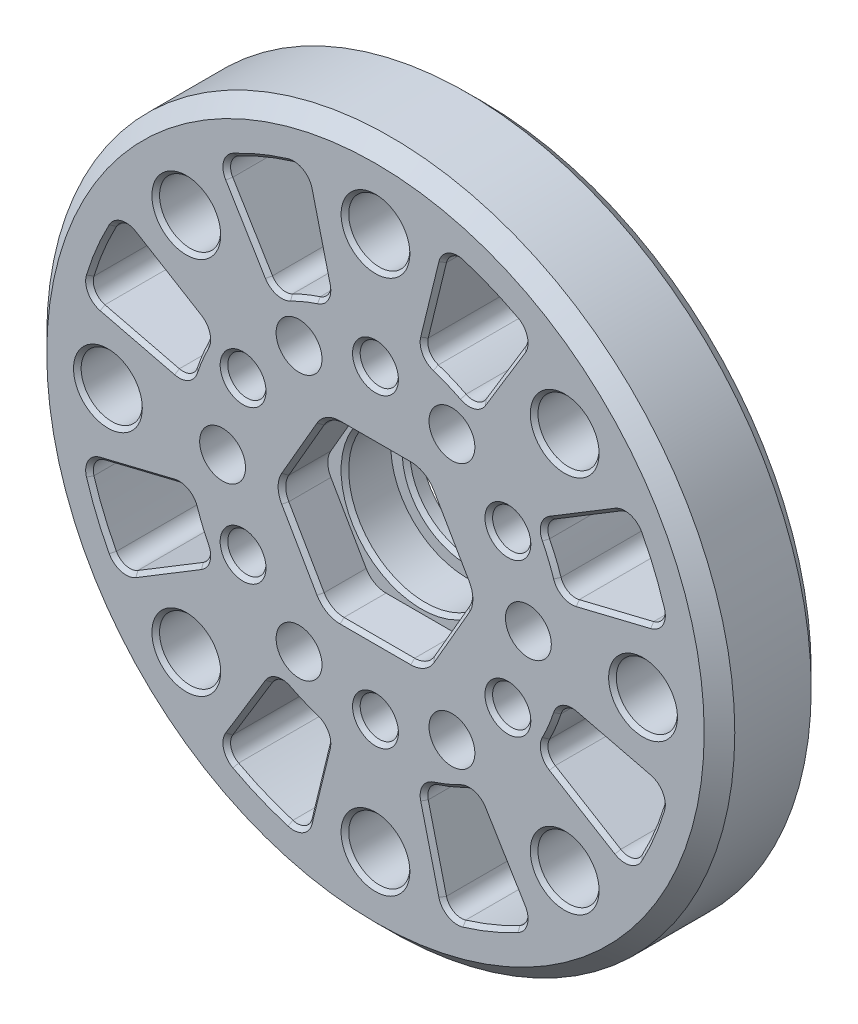
from build123d import *

# Parameters (mm, degrees)
SKETCH_1_R                       = 22.5
SKETCH_1_R_2                     = 2
EXTRUDE_1_DEPTH                  = 7
SKETCH_7_R                       = 5
SKETCH_7_R_2                     = 0.5
CUT_EXTRUDE_3_DEPTH              = 33.580669115
M3X0_5_1_D                       = 2.5
M3X0_5_1_CSINK_D                 = 3
M3X0_5_1_CSINK_ANGLE             = 90
CHAMFER_1_SIZE                   = 1
CUT_EXTRUDE_4_DEPTH              = 33.580669115
FILLET_1_R                       = 1
PATTERN_CIRCULAR_1_COUNT         = 8
FILLET_1_OF_PATTERN_CIRCULAR_1_R = 1
EXTRUDE_START                    = 1
SKETCH_12_R                      = 5
SKETCH_12_R_2                    = 4
EXTRUDE_3_DEPTH                  = 1
CHAMFER_3_SIZE                   = 0.25
CUT_EXTRUDE_6_DEPTH              = 3
FILLET_4_R                       = 1.5
CHAMFER_5_SIZE                   = 0.25
CHAMFER_8_SIZE                   = 0.25
SKETCH_18_R                      = 1.5
CUT_EXTRUDE_7_DEPTH              = 33.580669115


with BuildPart() as part:
    # ｽｹｯﾁ1 → ﾎﾞｽ - 押し出し1 (new body)
    with BuildSketch(Plane.XY):
        Circle(SKETCH_1_R)
        with Locations((0, 17.5)):
            Circle(SKETCH_1_R_2, mode=Mode.SUBTRACT)
        with Locations((12.374368671, 12.374368671)):
            Circle(SKETCH_1_R_2, mode=Mode.SUBTRACT)
        with Locations((17.5, 0)):
            Circle(SKETCH_1_R_2, mode=Mode.SUBTRACT)
        with Locations((12.374368671, -12.374368671)):
            Circle(SKETCH_1_R_2, mode=Mode.SUBTRACT)
        with Locations((0, -17.5)):
            Circle(SKETCH_1_R_2, mode=Mode.SUBTRACT)
        with Locations((-12.374368671, -12.374368671)):
            Circle(SKETCH_1_R_2, mode=Mode.SUBTRACT)
        with Locations((-17.5, 0)):
            Circle(SKETCH_1_R_2, mode=Mode.SUBTRACT)
        with Locations((-12.374368671, 12.374368671)):
            Circle(SKETCH_1_R_2, mode=Mode.SUBTRACT)
    extrude(amount=EXTRUDE_1_DEPTH)

    # ｽｹｯﾁ7 → ｶｯﾄ - 押し出し3 (cut, through all)
    with BuildSketch(Plane.XY.offset(7)):
        Circle(SKETCH_7_R)
        with Locations((0, 10)):
            Circle(SKETCH_7_R_2)
        with Locations((8.660254038, 5)):
            Circle(SKETCH_7_R_2)
        with Locations((8.660254038, -5)):
            Circle(SKETCH_7_R_2)
        with Locations((0, -10)):
            Circle(SKETCH_7_R_2)
        with Locations((-8.660254038, -5)):
            Circle(SKETCH_7_R_2)
        with Locations((-8.660254038, 5)):
            Circle(SKETCH_7_R_2)
    extrude(amount=-CUT_EXTRUDE_3_DEPTH, mode=Mode.SUBTRACT)

    # M3x0.5 ねじ穴1 (through all)
    with Locations(Plane.XY.offset(7)):
        with Locations((0, 10), (8.660254038, 5), (8.660254038, -5), (0, -10), (-8.660254038, -5), (-8.660254038, 5)):
            CounterSinkHole(M3X0_5_1_D / 2, M3X0_5_1_CSINK_D / 2, counter_sink_angle=M3X0_5_1_CSINK_ANGLE)

    # 面取り1
    chamfer_1_edges = [part.edges().sort_by_distance(p)[0] for p in [
        (-22.5, 0, 0),
        (-22.5, 0, 7),
    ]]
    chamfer(chamfer_1_edges, length=CHAMFER_1_SIZE)

    # ｽｹｯﾁ10 → ｶｯﾄ - 押し出し4 (cut, through all)
    with BuildSketch(Plane.XY.offset(7)):
        with BuildLine():
            Line((6.484665727, 10.686398383), (10.116078534, 16.670781478))
            ThreePointArc((10.116078534, 16.670781478), (7.462326931, 18.015650884), (4.6348749, 18.941170361))
            Line((4.6348749, 18.941170361), (2.971073654, 12.141775873))
            ThreePointArc((2.971073654, 12.141775873), (4.783542905, 11.548494156), (6.484665727, 10.686398383))
        make_face()
    cut_extrude_4 = extrude(amount=-CUT_EXTRUDE_4_DEPTH, mode=Mode.SUBTRACT)

    # ﾌｨﾚｯﾄ1
    fillet_1_edges = [part.edges().sort_by_distance(p)[0] for p in [
        (6.484665727, 10.686398383, 3.5),
        (2.971073654, 12.141775873, 3.5),
        (10.116078534, 16.670781478, 3.5),
        (4.6348749, 18.941170361, 3.5),
    ]]
    fillet(fillet_1_edges, radius=FILLET_1_R)

    # 円形ﾊﾟﾀｰﾝ1: ｶｯﾄ - 押し出し4 ×8 about axis
    pattern_circular_1_axis = Axis((0, 0, 0), (0, 0, 1))
    for i in range(1, PATTERN_CIRCULAR_1_COUNT):
        add(cut_extrude_4.rotate(pattern_circular_1_axis, i * 360 / PATTERN_CIRCULAR_1_COUNT), mode=Mode.SUBTRACT)

    # ﾌｨﾚｯﾄ1 of 円形ﾊﾟﾀｰﾝ1
    fillet_1_of_pattern_circular_1_edges = [part.edges().sort_by_distance(p)[0] for p in [
        (-2.971073654, 12.141775873, 3.5),
        (-6.484665727, 10.686398383, 3.5),
        (-4.6348749, 18.941170361, 3.5),
        (-10.116078534, 16.670781478, 3.5),
        (-10.686398383, 6.484665727, 3.5),
        (-12.141775873, 2.971073654, 3.5),
        (-16.670781478, 10.116078534, 3.5),
        (-18.941170361, 4.6348749, 3.5),
        (-12.141775873, -2.971073654, 3.5),
        (-10.686398383, -6.484665727, 3.5),
        (-18.941170361, -4.6348749, 3.5),
        (-16.670781478, -10.116078534, 3.5),
        (-6.484665727, -10.686398383, 3.5),
        (-2.971073654, -12.141775873, 3.5),
        (-10.116078534, -16.670781478, 3.5),
        (-4.6348749, -18.941170361, 3.5),
        (2.971073654, -12.141775873, 3.5),
        (6.484665727, -10.686398383, 3.5),
        (4.6348749, -18.941170361, 3.5),
        (10.116078534, -16.670781478, 3.5),
        (10.686398383, -6.484665727, 3.5),
        (12.141775873, -2.971073654, 3.5),
        (16.670781478, -10.116078534, 3.5),
        (18.941170361, -4.6348749, 3.5),
        (12.141775873, 2.971073654, 3.5),
        (10.686398383, 6.484665727, 3.5),
        (18.941170361, 4.6348749, 3.5),
        (16.670781478, 10.116078534, 3.5),
    ]]
    fillet(fillet_1_of_pattern_circular_1_edges, radius=FILLET_1_OF_PATTERN_CIRCULAR_1_R)

    # ｽｹｯﾁ12 → ﾎﾞｽ - 押し出し3 (add)
    with BuildSketch(Plane.XY.offset(EXTRUDE_START)):
        Circle(SKETCH_12_R)
        Circle(SKETCH_12_R_2, mode=Mode.SUBTRACT)
    extrude(amount=-EXTRUDE_3_DEPTH)

    # 面取り3
    chamfer_3_edges = [part.edges().sort_by_distance(p)[0] for p in [
        (-4, 0, 1),
        (-2, 17.5, 7),
        (10.374368671, 12.374368671, 7),
        (15.5, 0, 7),
        (10.374368671, -12.374368671, 7),
        (-2, -17.5, 7),
        (-14.374368671, -12.374368671, 7),
        (-19.5, 0, 7),
        (-14.374368671, 12.374368671, 7),
    ]]
    chamfer(chamfer_3_edges, length=CHAMFER_3_SIZE)

    # ｽｹｯﾁ14 → ｶｯﾄ - 押し出し6 (cut)
    with BuildSketch(Plane.XY.offset(7)):
        Polygon((3.175426481, 5.5), (-3.175426481, 5.5), (-6.350852961, 0), (-3.175426481, -5.5), (3.175426481, -5.5), (6.350852961, 0), align=None)
    extrude(amount=-CUT_EXTRUDE_6_DEPTH, mode=Mode.SUBTRACT)

    # ﾌｨﾚｯﾄ4
    fillet_4_edges = [part.edges().sort_by_distance(p)[0] for p in [
        (3.175426481, -5.5, 5.5),
        (6.350852961, 0, 5.5),
        (3.175426481, 5.5, 5.5),
        (-6.350852961, 0, 5.5),
        (-3.175426481, -5.5, 5.5),
        (-3.175426481, 5.5, 5.5),
    ]]
    fillet(fillet_4_edges, radius=FILLET_4_R)

    # 面取り5
    chamfer_5_edges = [part.edges().sort_by_distance(p)[0] for p in [
        (-5, 0, 4),
        (6.118802154, 0, 7),
        (4.763139721, -2.75, 7),
        (4.763139721, 2.75, 7),
        (3.059401077, -5.299038106, 7),
        (3.059401077, 5.299038106, 7),
        (0, -5.5, 7),
        (0, 5.5, 7),
        (-3.059401077, -5.299038106, 7),
        (-3.059401077, 5.299038106, 7),
        (-4.763139721, -2.75, 7),
        (-4.763139721, 2.75, 7),
        (-6.118802154, 0, 7),
    ]]
    chamfer(chamfer_5_edges, length=CHAMFER_5_SIZE)

    # 面取り8
    chamfer_8_edges = [part.edges().sort_by_distance(p)[0] for p in [
        (-18.015650884, -7.462326931, 7),
        (-16.575381329, -9.69292294, 7),
        (-18.574496078, -4.866632998, 7),
        (-13.651175138, -8.283736426, 7),
        (-15.510324712, -3.795352311, 7),
        (-11.066511081, -6.402809818, 7),
        (-12.35267527, -3.297734789, 7),
        (-11.548494156, -4.783542905, 7),
        (-7.462326931, -18.015650884, 7),
        (-4.866632998, -18.574496078, 7),
        (-9.69292294, -16.575381329, 7),
        (-3.795352311, -15.510324712, 7),
        (-8.283736426, -13.651175138, 7),
        (-3.297734789, -12.35267527, 7),
        (-6.402809818, -11.066511081, 7),
        (-4.783542905, -11.548494156, 7),
        (7.462326931, -18.015650884, 7),
        (9.69292294, -16.575381329, 7),
        (4.866632998, -18.574496078, 7),
        (8.283736426, -13.651175138, 7),
        (3.795352311, -15.510324712, 7),
        (6.402809818, -11.066511081, 7),
        (3.297734789, -12.35267527, 7),
        (4.783542905, -11.548494156, 7),
        (15.510324712, 3.795352311, 7),
        (18.574496078, 4.866632998, 7),
        (12.35267527, 3.297734789, 7),
        (18.015650884, 7.462326931, 7),
        (11.548494156, 4.783542905, 7),
        (16.575381329, 9.69292294, 7),
        (11.066511081, 6.402809818, 7),
        (13.651175138, 8.283736426, 7),
        (4.783542905, 11.548494156, 7),
        (6.402809818, 11.066511081, 7),
        (3.297734789, 12.35267527, 7),
        (8.283736426, 13.651175138, 7),
        (3.795352311, 15.510324712, 7),
        (9.69292294, 16.575381329, 7),
        (4.866632998, 18.574496078, 7),
        (7.462326931, 18.015650884, 7),
        (-4.783542905, 11.548494156, 7),
        (-3.297734789, 12.35267527, 7),
        (-6.402809818, 11.066511081, 7),
        (-3.795352311, 15.510324712, 7),
        (-8.283736426, 13.651175138, 7),
        (-4.866632998, 18.574496078, 7),
        (-9.69292294, 16.575381329, 7),
        (-7.462326931, 18.015650884, 7),
        (-15.510324712, 3.795352311, 7),
        (-12.35267527, 3.297734789, 7),
        (-18.574496078, 4.866632998, 7),
        (-11.548494156, 4.783542905, 7),
        (-18.015650884, 7.462326931, 7),
        (-11.066511081, 6.402809818, 7),
        (-16.575381329, 9.69292294, 7),
        (-13.651175138, 8.283736426, 7),
        (15.510324712, -3.795352311, 7),
        (12.35267527, -3.297734789, 7),
        (18.574496078, -4.866632998, 7),
        (11.548494156, -4.783542905, 7),
        (18.015650884, -7.462326931, 7),
        (11.066511081, -6.402809818, 7),
        (16.575381329, -9.69292294, 7),
        (13.651175138, -8.283736426, 7),
    ]]
    chamfer(chamfer_8_edges, length=CHAMFER_8_SIZE)

    # ｽｹｯﾁ18 → ｶｯﾄ - 押し出し7 (cut, through all)
    with BuildSketch(Plane.XY.offset(7)):
        with Locations((5, 8.660254038)):
            Circle(SKETCH_18_R)
        with Locations((10, 0)):
            Circle(SKETCH_18_R)
        with Locations((5, -8.660254038)):
            Circle(SKETCH_18_R)
        with Locations((-5, -8.660254038)):
            Circle(SKETCH_18_R)
        with Locations((-10, 0)):
            Circle(SKETCH_18_R)
        with Locations((-5, 8.660254038)):
            Circle(SKETCH_18_R)
    extrude(amount=-CUT_EXTRUDE_7_DEPTH, mode=Mode.SUBTRACT)


solid = part.part
